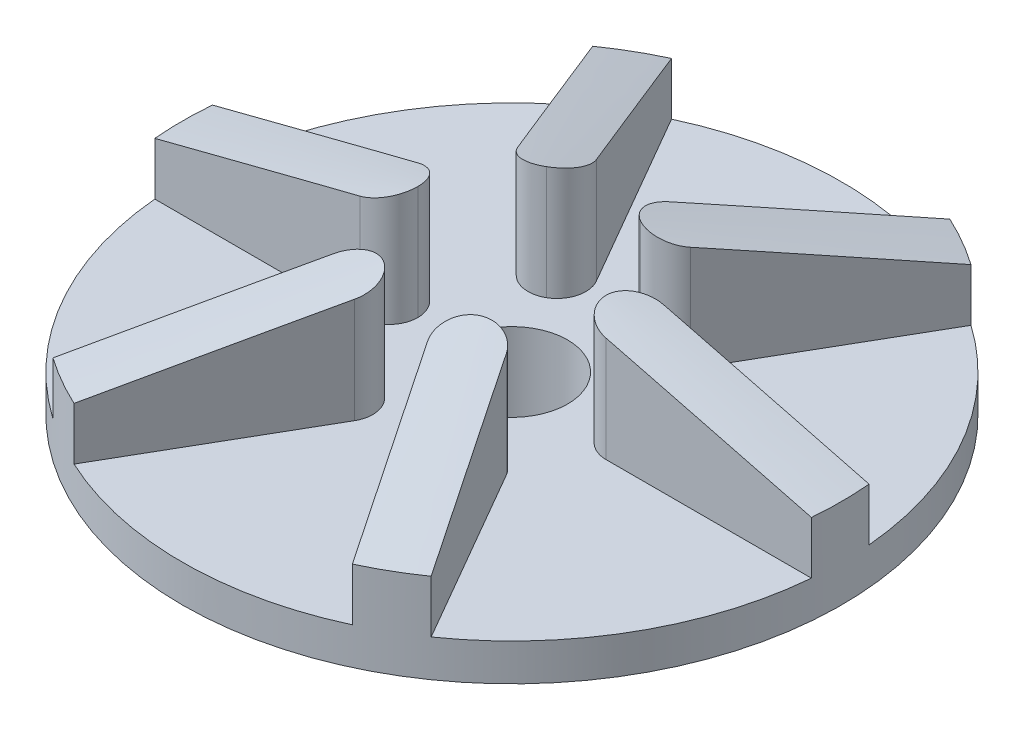
from build123d import *
from build123d.topology import SkipClean

# Parameters (mm, degrees)
SKETCH1_R           = 17.78
BASE_DEPTH          = 2
SKETCH2_R           = 8
BOSS_DEPTH          = 5
BLADE_DEPTH         = 6.124181873
BLADE_PATTERN_COUNT = 6
SKETCH6_R           = 3
BORE_CUT_DEPTH      = 20
DOWEL_CUT_DEPTH     = 2
FILLET1_R           = 1.555908557


with BuildPart() as part:
    # Sketch1 → base (new body)
    with BuildSketch(Plane(origin=(0, 0, 0), x_dir=(1, 0, 0), z_dir=(0, 1, 0))):
        with Locations(Location((0, 0, 0), (0, 0, 270))):
            Circle(SKETCH1_R)
    extrude(amount=BASE_DEPTH)

    # Sketch2 → boss (add)
    with BuildSketch(Plane.XZ):
        with Locations(Location((0, 0, 0), (0, 0, 90))):
            Circle(SKETCH2_R)
    extrude(amount=BOSS_DEPTH)

    # Sketch3 → blade (add)
    with SkipClean():  # the faces are left unmerged after this step: merging them gives an invalid solid
        with BuildSketch(Plane(origin=(0, 2, 0), x_dir=(1, 0, 0), z_dir=(0, 1, 0))):
            with BuildLine():
                Line((4.835860685, 1.555908557), (17.71179123, 1.555908557))
                ThreePointArc((17.71179123, 1.555908557), (17.78, 0), (17.71179123, -1.555908557))
                Line((17.71179123, -1.555908557), (4.835860685, -1.555908557))
                ThreePointArc((4.835860685, -1.555908557), (5.08, 0), (4.835860685, 1.555908557))
            make_face()
        blade = extrude(amount=BLADE_DEPTH)

    # blade pattern: blade ×6 about axis
    with SkipClean():  # the faces are left unmerged after this step: merging them gives an invalid solid
        blade_pattern_axis = Axis((0, 0, 0), (0, 1, 0))
        for i in range(1, BLADE_PATTERN_COUNT):
            add(blade.rotate(blade_pattern_axis, i * 360 / BLADE_PATTERN_COUNT))

    # Sketch5 → angle trim (revolve, cut)
    with SkipClean():  # the faces are left unmerged after this step: merging them gives an invalid solid
        with BuildSketch(Plane.XY, mode=Mode.PRIVATE) as angle_trim_sk:
            Polygon((-17.78, 8.124181873), (-17.78, 4.83718), (-5.08, 8.124181873), align=None)
        revolve(angle_trim_sk.sketch.rotate(Axis((0, 0, 0), (0, 1, 0)), 245.020313047), axis=Axis((0, 0, 0), (0, 1, 0)), mode=Mode.SUBTRACT)

    # Sketch6 → bore_cut (cut)
    with SkipClean():  # the faces are left unmerged after this step: merging them gives an invalid solid
        with BuildSketch(Plane(origin=(0, -5, 0), x_dir=(-1, 0, 0), z_dir=(0, -1, 0))):
            with Locations(Location((0, 0, 0), (0, 0, 90))):
                Circle(SKETCH6_R)
        extrude(amount=-BORE_CUT_DEPTH, mode=Mode.SUBTRACT)

    # Sketch7 → dowel cut (cut)
    with SkipClean():  # the faces are left unmerged after this step: merging them gives an invalid solid
        with BuildSketch(Plane.XZ.offset(5)):
            with BuildLine():
                Line((-5, -1), (5, -1))
                ThreePointArc((5, -1), (6, 0), (5, 1))
                Line((5, 1), (-5, 1))
                ThreePointArc((-5, 1), (-6, 0), (-5, -1))
            make_face()
        extrude(amount=-DOWEL_CUT_DEPTH, mode=Mode.SUBTRACT)

    # Fillet1
    # the kernel refuses this fillet: 1.555908557 mm, written as the material it takes off along each edge
    with BuildSketch(Plane(origin=(-4.835860685, 2, -1.555908557), x_dir=(-0.15501438697243256, 0, 0.9879122126138338), z_dir=(0, 1, 0)), Plane(origin=(-1.070474006, 2, -4.965932481), x_dir=(-0.93306426631869, 0, 0.3597097092367188), z_dir=(0, 1, 0)), Plane(origin=(-3.765386679, 2, 3.410023924), x_dir=(0.7780498793462566, 0, 0.6282025033771159), z_dir=(0, 1, 0))) as fillet1_piece_1:
        with BuildLine():
            CenterArc((1.816134383, -1.537101065), FILLET1_R, 98.917630651, 90)
            Line((0.279033317, -1.778289277), (0, 0))
            ThreePointArc((0, 0), (0.787473086, -0.06140596), (1.574946172, 0))
        make_face()
    extrude(amount=10.624301554, mode=Mode.SUBTRACT)
    with BuildSketch(Plane(origin=(-4.835860685, 2, 1.555908557), x_dir=(-1, 0, 0), z_dir=(0, 1, 0)), Plane(origin=(-3.765386679, 2, -3.410023924), x_dir=(-0.49999999999999994, 0, -0.8660254037844388), z_dir=(0, 1, 0)), Plane(origin=(-1.070474006, 2, 4.965932481), x_dir=(-0.5000000000000002, 0, 0.8660254037844385), z_dir=(0, 1, 0))) as fillet1_piece_2:
        with BuildLine():
            CenterArc((1.800047872, -1.555908557), FILLET1_R, 90, 90)
            ThreePointArc((0.244139315, -1.555908557), (0.182733355, -0.768435471), (0, 0))
            Line((0, 0), (1.800047872, 0))
        make_face()
    extrude(amount=10.624301554, mode=Mode.SUBTRACT)
    with BuildSketch(Plane(origin=(4.835860685, 2, 1.555908557), x_dir=(1, 0, 0), z_dir=(0, 1, 0)), Plane(origin=(3.765386679, 2, -3.410023924), x_dir=(0.5000000000000002, 0, -0.8660254037844386), z_dir=(0, 1, 0)), Plane(origin=(1.070474006, 2, 4.965932481), x_dir=(0.5000000000000007, 0, 0.8660254037844383), z_dir=(0, 1, 0))) as fillet1_piece_3:
        with BuildLine():
            CenterArc((1.800047872, 1.555908557), FILLET1_R, 180, 90)
            ThreePointArc((0.244139315, 1.555908557), (0.182733355, 0.768435471), (0, 0))
            Line((0, 0), (1.800047872, 0))
        make_face()
    extrude(amount=10.624301554, mode=Mode.SUBTRACT)
    with BuildSketch(Plane(origin=(4.835860685, 2, -1.555908557), x_dir=(0.15501438697243264, 0, 0.9879122126138339), z_dir=(0, 1, 0)), Plane(origin=(1.070474006, 2, -4.965932481), x_dir=(0.9330642663186902, 0, 0.35970970923671797), z_dir=(0, 1, 0)), Plane(origin=(3.765386679, 2, 3.410023924), x_dir=(-0.7780498793462572, 0, 0.6282025033771153), z_dir=(0, 1, 0))) as fillet1_piece_4:
        with BuildLine():
            CenterArc((1.816134383, 1.537101065), FILLET1_R, 171.082369349, 90)
            Line((0.279033317, 1.778289277), (0, 0))
            ThreePointArc((0, 0), (0.787473086, 0.06140596), (1.574946172, 0))
        make_face()
    extrude(amount=10.624301554, mode=Mode.SUBTRACT)


solid = part.part
